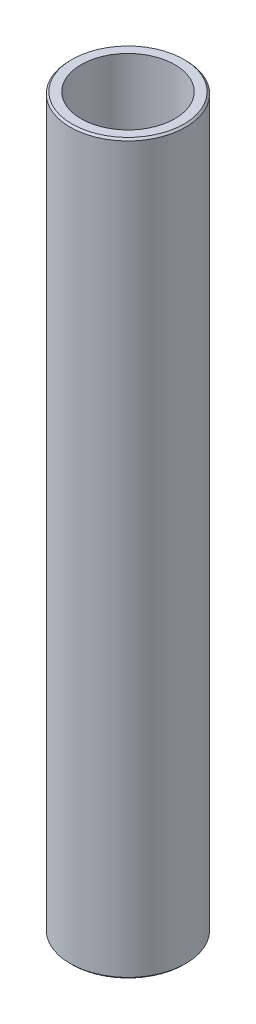
from build123d import *

# Parameters (mm, degrees)
SKETCH1_R           = 7.94
SKETCH1_R_2         = 6.44
BOSS_EXTRUDE1_DEPTH = 100
CHAMFER1_SIZE       = 0.25


with BuildPart() as part:
    # Sketch1 → Boss-Extrude1 (new body)
    with BuildSketch(Plane(origin=(0, 0, 0), x_dir=(1, 0, 0), z_dir=(0, 1, 0))):
        Circle(SKETCH1_R)
        Circle(SKETCH1_R_2, mode=Mode.SUBTRACT)
    extrude(amount=BOSS_EXTRUDE1_DEPTH)

    # Chamfer1
    chamfer1_edges = [part.edges().sort_by_distance(p)[0] for p in [
        (-7.94, 0, 0),
        (-7.94, 100, 0),
    ]]
    chamfer(chamfer1_edges, length=CHAMFER1_SIZE)


solid = part.part
